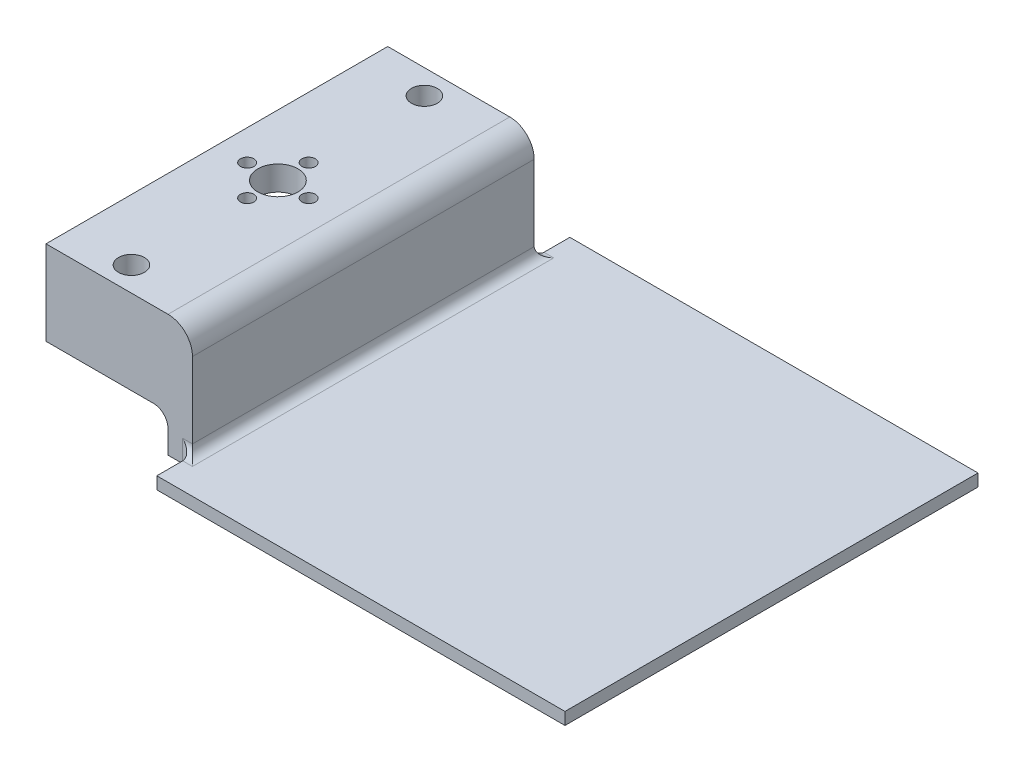
from build123d import *

# Parameters (mm, degrees)
SKETCH1_W           = 106.172
SKETCH1_H           = 107.442
BOSS_EXTRUDE1_DEPTH = 3.175
SKETCH13_W          = 38.1
SKETCH13_H          = 88.9
BOSS_EXTRUDE7_DEPTH = 31.75
SKETCH15_R          = 3.3655
SKETCH15_R_2        = 5.22699996
SKETCH15_R_3        = 1.750000056
CUT_EXTRUDE1_DEPTH  = 124.152352495
SKETCH17_W          = 63.5
SKETCH17_H          = 25.4
CUT_EXTRUDE2_DEPTH  = 31.75
SKETCH18_W          = 31.75
SKETCH18_H          = 9.779
CUT_EXTRUDE3_DEPTH  = 149.047631947
FILLET2_R           = 12.7
FILLET1_R           = 3.81
FILLET3_R           = 2.54
FILLET4_R           = 2.54
FILLET5_R           = 6.35


with BuildPart() as part:
    # Sketch1 → Boss-Extrude1 (new body)
    with BuildSketch(Plane(origin=(0, 0, 0), x_dir=(1, 0, 0), z_dir=(0, 1, 0))):
        with Locations((53.086, 0)):
            Rectangle(SKETCH1_W, SKETCH1_H)
    extrude(amount=BOSS_EXTRUDE1_DEPTH)

    # Sketch13 → Boss-Extrude7 (add)
    with BuildSketch(Plane(origin=(0, 0, 0), x_dir=(1, 0, 0), z_dir=(0, 1, 0))):
        with Locations((-19.05, 0)):
            Rectangle(SKETCH13_W, SKETCH13_H)
    extrude(amount=BOSS_EXTRUDE7_DEPTH)

    # Sketch15 → Cut-Extrude1 (cut, through all)
    with BuildSketch(Plane(origin=(0, 31.75, 0), x_dir=(1, 0, 0), z_dir=(0, 1, 0))):
        with Locations(Location((-22.225, 38.1, 0), (0, 0, 270))):
            Circle(SKETCH15_R)
        with Locations(Location((-22.225, -38.1, 0), (0, 0, 270))):
            Circle(SKETCH15_R)
        with Locations(Location((-22.225, 0, 0), (0, 0, 270))):
            Circle(SKETCH15_R_2)
        with Locations(Location((-14.224999998, 0, 0), (0, 0, 270))):
            Circle(SKETCH15_R_3)
        with Locations(Location((-22.225, -8.000000002, 0), (0, 0, 270))):
            Circle(SKETCH15_R_3)
        with Locations(Location((-30.225000002, 0, 0), (0, 0, 270))):
            Circle(SKETCH15_R_3)
        with Locations(Location((-22.225, 8.000000002, 0), (0, 0, 270))):
            Circle(SKETCH15_R_3)
    extrude(amount=-CUT_EXTRUDE1_DEPTH, mode=Mode.SUBTRACT)

    # Sketch17 → Cut-Extrude2 (cut)
    with BuildSketch(Plane.ZY.offset(38.1)):
        with Locations((0, 12.7)):
            Rectangle(SKETCH17_W, SKETCH17_H)
    extrude(amount=-CUT_EXTRUDE2_DEPTH, mode=Mode.SUBTRACT)

    # Sketch18 → Cut-Extrude3 (cut, through all)
    with BuildSketch(Plane(origin=(0, 0, -44.45), x_dir=(-1, 0, 0), z_dir=(0, 0, -1))):
        with Locations((22.225, 4.8895)):
            Rectangle(SKETCH18_W, SKETCH18_H)
    extrude(amount=-CUT_EXTRUDE3_DEPTH, mode=Mode.SUBTRACT)

    # Fillet2
    fillet2_edges = [part.edges().sort_by_distance(p)[0] for p in [
        (-22.225, 25.4, -31.75),
        (-22.225, 25.4, 31.75),
    ]]
    fillet(fillet2_edges, radius=FILLET2_R)

    # Fillet1
    fillet1_edges = [part.edges().sort_by_distance(p)[0] for p in [
        (-6.35, 9.779, 38.1),
        (-6.35, 9.779, -38.1),
        (-6.35, 25.4, 0),
        (-6.35, 11.2395, 31.75),
        (-6.35, 21.680256121, -28.030256121),
        (-6.35, 21.680256121, 28.030256121),
        (-6.35, 11.2395, -31.75),
    ]]
    fillet(fillet1_edges, radius=FILLET1_R)

    # Fillet3
    fillet3_edges = [part.edges().sort_by_distance(p)[0] for p in [
        (0, 3.175, 0),
    ]]
    fillet(fillet3_edges, radius=FILLET3_R)

    # Fillet4
    fillet4_edges = [part.edges().sort_by_distance(p)[0] for p in [
        (1.27, 3.175, 44.45),
        (1.27, 3.175, -44.45),
        (0, 1.5875, 44.45),
        (0, 1.5875, -44.45),
    ]]
    fillet(fillet4_edges, radius=FILLET4_R - 0.0001)  # a hair under: the kernel refuses the full size

    # Fillet5
    fillet5_edges = [part.edges().sort_by_distance(p)[0] for p in [
        (0, 31.75, 0),
    ]]
    fillet(fillet5_edges, radius=FILLET5_R)


solid = part.part
